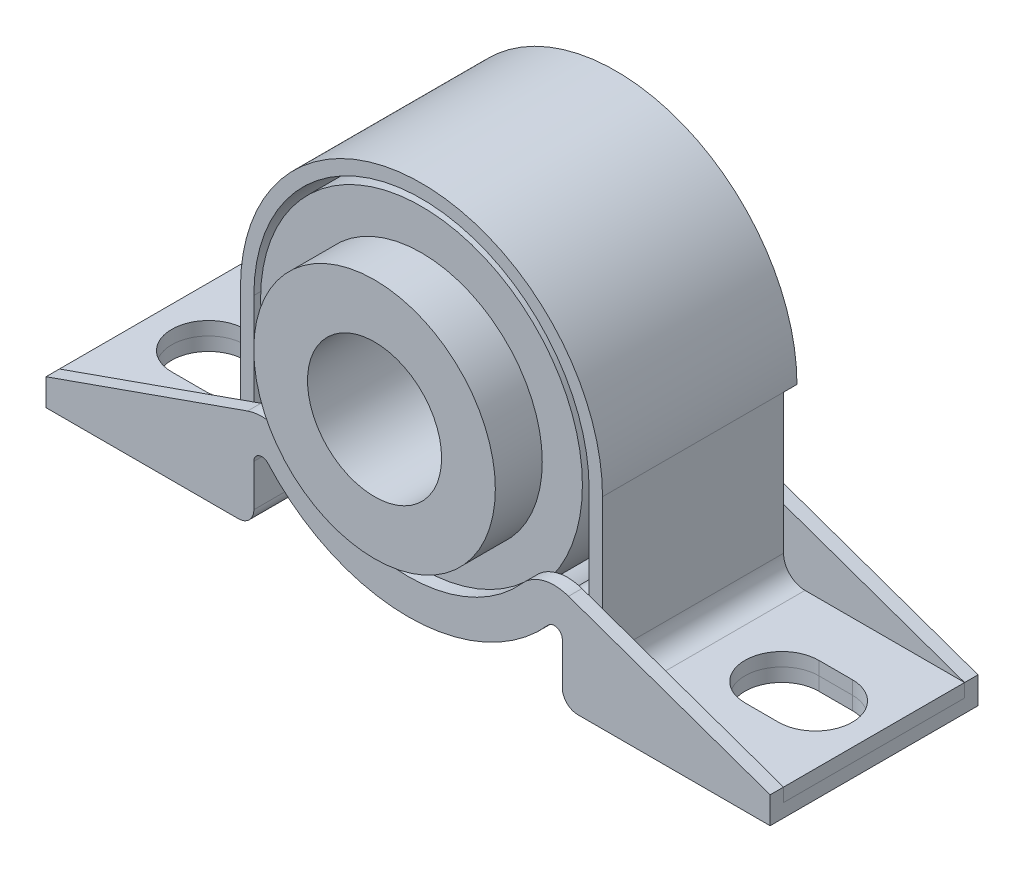
from build123d import *

# Parameters (mm, degrees)
EXTRUDE_THIN2_DEPTH  = 12.303125
EXTRUDE1_DEPTH       = 1.5875
EXTRUDE_THIN3_START  = -10.715625
EXTRUDE_THIN3_DEPTH  = 21.43125
EXTRUDE2_DEPTH       = 1.5875
EXTRUDE3_START       = -10.715625
EXTRUDE3_OUTLINE_R   = 19.05
EXTRUDE3_OUTLINE_R_2 = 14.3002
EXTRUDE3_DEPTH       = 21.43125
SKETCH8_R            = 14.3002
SKETCH8_R_2          = 7.9375
EXTRUDE4_DEPTH       = 21.99894
CUT_EXTRUDE1_DEPTH   = 51.950156499


# Read off the part's stored shape, not the designer's step: Extrude-Thin3, Extrude3
with BuildPart() as part:
    # Sketch1 → Extrude-Thin2 (new, symmetric)
    with BuildSketch(Plane.XY):
        with BuildLine():
            Line((-42.8625, -20.6375), (-20.09775, -20.6375))
            ThreePointArc((-20.09775, -20.6375), (-19.918144878, -20.563105122), (-19.84375, -20.3835))
            Line((-19.84375, -20.3835), (-19.84375, -15.420011096))
            ThreePointArc((-19.84375, -15.420011096), (-18.207905551, -13.0463846), (-15.40744863, -13.730146866))
            ThreePointArc((-15.40744863, -13.730146866), (0, -20.6375), (15.40744863, -13.730146866))
            ThreePointArc((15.40744863, -13.730146866), (18.207905551, -13.0463846), (19.84375, -15.420011096))
            Line((19.84375, -15.420011096), (19.84375, -20.3835))
            ThreePointArc((19.84375, -20.3835), (19.918144878, -20.563105122), (20.09775, -20.6375))
            Line((20.09775, -20.6375), (42.8625, -20.6375))
            Line((42.8625, -20.6375), (42.8625, -22.225))
            Line((42.8625, -22.225), (20.09775, -22.225))
            ThreePointArc((20.09775, -22.225), (18.795612862, -21.685637138), (18.25625, -20.3835))
            Line((18.25625, -20.3835), (18.25625, -15.420011096))
            ThreePointArc((18.25625, -15.420011096), (17.642808332, -14.52990116), (16.592636986, -14.786312009))
            ThreePointArc((16.592636986, -14.786312009), (0, -22.225), (-16.592636986, -14.786312009))
            ThreePointArc((-16.592636986, -14.786312009), (-17.642808332, -14.52990116), (-18.25625, -15.420011096))
            Line((-18.25625, -15.420011096), (-18.25625, -20.3835))
            ThreePointArc((-18.25625, -20.3835), (-18.795612862, -21.685637138), (-20.09775, -22.225))
            Line((-20.09775, -22.225), (-42.8625, -22.225))
            Line((-42.8625, -22.225), (-42.8625, -20.6375))
        make_face()
    extrude(amount=EXTRUDE_THIN2_DEPTH, both=True)

    # Sketch4 → Extrude1 (add)
    with BuildSketch(Plane.XY.offset(12.303125)):
        with BuildLine():
            Line((-42.8625, -19.05), (-18.993828558, -10.629391671))
            ThreePointArc((-18.993828558, -10.629391671), (-16.037730525, -10.500296197), (-13.51114726, -12.040282636))
            ThreePointArc((-13.51114726, -12.040282636), (0, -18.0975), (13.51114726, -12.040282636))
            ThreePointArc((13.51114726, -12.040282636), (16.037730525, -10.500296197), (18.993828558, -10.629391671))
            Line((18.993828558, -10.629391671), (42.8625, -19.05))
            Line((42.8625, -19.05), (42.8625, -22.225))
            Line((42.8625, -22.225), (20.09775, -22.225))
            ThreePointArc((20.09775, -22.225), (18.795612862, -21.685637138), (18.25625, -20.3835))
            Line((18.25625, -20.3835), (18.25625, -15.420011096))
            ThreePointArc((18.25625, -15.420011096), (17.642808332, -14.52990116), (16.592636986, -14.786312009))
            ThreePointArc((16.592636986, -14.786312009), (0, -22.225), (-16.592636986, -14.786312009))
            ThreePointArc((-16.592636986, -14.786312009), (-17.642808332, -14.52990116), (-18.25625, -15.420011096))
            Line((-18.25625, -15.420011096), (-18.25625, -20.3835))
            ThreePointArc((-18.25625, -20.3835), (-18.795612862, -21.685637138), (-20.09775, -22.225))
            Line((-20.09775, -22.225), (-42.8625, -22.225))
            Line((-42.8625, -22.225), (-42.8625, -19.05))
        make_face()
    extrude1 = extrude(amount=-EXTRUDE1_DEPTH)

    # Mirror1: Extrude1 across plane
    add(extrude1.mirror(Plane.XY))


with BuildPart() as body_2:
    # Extrude-Thin3 outline → Extrude-Thin3 (new body)
    with BuildSketch(Plane.XY.offset(EXTRUDE_THIN3_START)):
        with BuildLine():
            Line((-23.97125, -19.05), (-42.8625, -19.05))
            Line((-42.8625, -19.05), (-42.8625, -20.6375))
            Line((-42.8625, -20.6375), (-23.97125, -20.6375))
            ThreePointArc((-23.97125, -20.6375), (-21.052666761, -19.428583239), (-19.84375, -16.51))
            Line((-19.84375, -16.51), (-19.84375, 0))
            ThreePointArc((-19.84375, 0), (0, 19.84375), (19.84375, 0))
            Line((19.84375, 0), (19.84375, -16.51))
            ThreePointArc((19.84375, -16.51), (21.052666761, -19.428583239), (23.97125, -20.6375))
            Line((23.97125, -20.6375), (42.8625, -20.6375))
            Line((42.8625, -20.6375), (42.8625, -19.05))
            Line((42.8625, -19.05), (23.97125, -19.05))
            ThreePointArc((23.97125, -19.05), (22.175198776, -18.306051224), (21.43125, -16.51))
            Line((21.43125, -16.51), (21.43125, 0))
            ThreePointArc((21.43125, 0), (0, 21.43125), (-21.43125, 0))
            Line((-21.43125, 0), (-21.43125, -16.51))
            ThreePointArc((-21.43125, -16.51), (-22.175198776, -18.306051224), (-23.97125, -19.05))
        make_face()
    extrude(amount=EXTRUDE_THIN3_DEPTH)

    # Sketch6 → Extrude2 (add)
    with BuildSketch(Plane(origin=(0, 0, -10.715625), x_dir=(-1, 0, 0), z_dir=(0, 0, -1))):
        with BuildLine():
            Line((-19.84375, 0), (-21.43125, 0))
            ThreePointArc((-21.43125, 0), (0, 21.43125), (21.43125, 0))
            Line((21.43125, 0), (19.84375, 0))
            ThreePointArc((19.84375, 0), (18.610270538, 0.477999494), (18.020989833, 1.662357273))
            ThreePointArc((18.020989833, 1.662357273), (0, 18.0975), (-18.020989833, 1.662357273))
            ThreePointArc((-18.020989833, 1.662357273), (-18.610270538, 0.477999494), (-19.84375, 0))
        make_face()
    extrude(amount=EXTRUDE2_DEPTH)


with BuildPart() as body_3:
    # Extrude3 outline → Extrude3 (new body)
    with BuildSketch(Plane.XY.offset(EXTRUDE3_START)):
        Circle(EXTRUDE3_OUTLINE_R)
        Circle(EXTRUDE3_OUTLINE_R_2, mode=Mode.SUBTRACT)
    extrude(amount=EXTRUDE3_DEPTH)


with BuildPart() as body_4:
    # Sketch8 → Extrude4 (new body)
    with BuildSketch(Plane.XY.offset(16.271875)):
        Circle(SKETCH8_R)
        Circle(SKETCH8_R_2, mode=Mode.SUBTRACT)
    extrude(amount=-EXTRUDE4_DEPTH)


with BuildPart() as cut_extrude1_tool:
    # Sketch3 → Cut-Extrude1 (new, through all)
    with BuildSketch(Plane(origin=(0, 0, 0), x_dir=(1, 0, 0), z_dir=(0, 1, 0))):
        with BuildLine():
            Line((-35.9171875, 4.365625), (-31.9484375, 4.365625))
            ThreePointArc((-31.9484375, 4.365625), (-27.5828125, 0), (-31.9484375, -4.365625))
            Line((-31.9484375, -4.365625), (-35.9171875, -4.365625))
            ThreePointArc((-35.9171875, -4.365625), (-40.2828125, 0), (-35.9171875, 4.365625))
        make_face()
        with BuildLine():
            Line((31.9484375, -4.365625), (35.9171875, -4.365625))
            ThreePointArc((35.9171875, -4.365625), (40.2828125, 0), (35.9171875, 4.365625))
            Line((35.9171875, 4.365625), (31.9484375, 4.365625))
            ThreePointArc((31.9484375, 4.365625), (27.5828125, 0), (31.9484375, -4.365625))
        make_face()
    extrude(amount=-CUT_EXTRUDE1_DEPTH)


with BuildPart() as part_1:
    add(part.part)

    # Cut-Extrude1: cut by cut_extrude1_tool
    add(cut_extrude1_tool.part, mode=Mode.SUBTRACT)


with BuildPart() as body_2_1:
    add(body_2.part)

    # Cut-Extrude1: cut by cut_extrude1_tool
    add(cut_extrude1_tool.part, mode=Mode.SUBTRACT)


solid = Compound([body_3.part, body_4.part, part_1.part, body_2_1.part])
